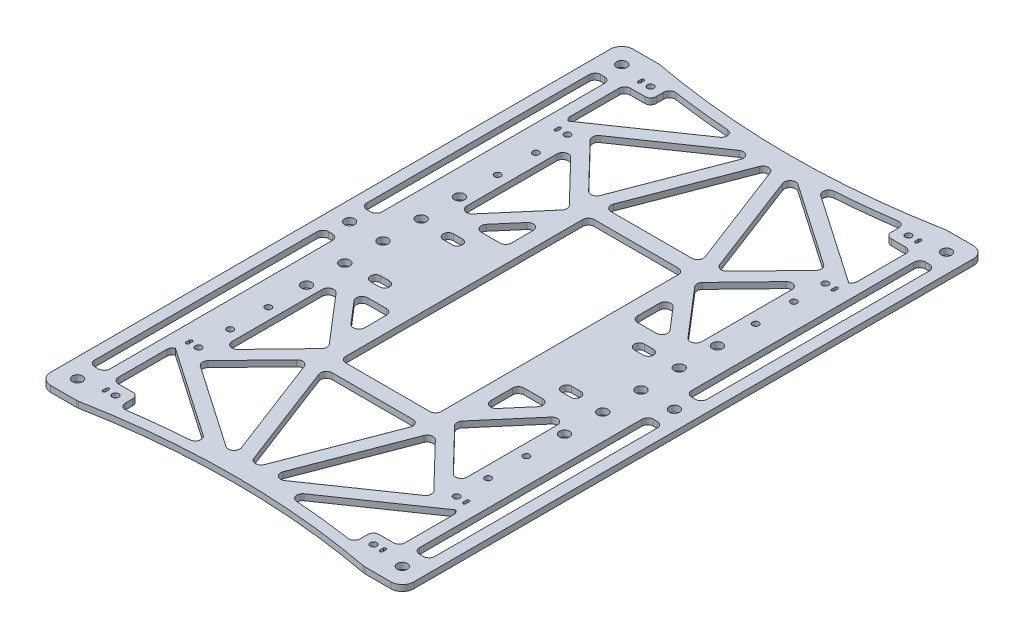
from build123d import *

# Parameters (mm, degrees)
SKETCH1_W                           = 190
SKETCH1_H                           = 304.8
EXTRUDE_RECTANGLE_DEPTH             = 3.175
SKETCH2_W                           = 50
SKETCH2_H                           = 130
WHEEL_HOLE_DEPTH                    = 180.613030221
M5_START                            = -1
M5_CLEARANCE_SLOT2_DEPTH            = 5
SKETCH12_R                          = 2.65
SKETCH12_W                          = 8
SKETCH12_H                          = 122.4
F_8020_STUFF_DEPTH                  = 10
SKETCH22_R                          = 1.65
LITTLE_HOLES_DEPTH                  = 10
SKETCH27_R                          = 2.65
BIG_HOLES_DEPTH                     = 180.613030221
SKETCH28_R                          = 1.65
ODRIVE_HOLES_DEPTH                  = 180.613030221
HOLLOWING_DEPTH                     = 10
TRUSS_DEPTH                         = 3.175
HOLLOWING_TRUSS_MIRROR_COPY_1_DEPTH = 3.175
INNER_START                         = -1
INNER_FILLET_DEPTH                  = 5
INNER_FILLET_2_DEPTH                = 3.175
OUTER_FILLET_R                      = 6


with BuildPart() as part:
    # Sketch1 → extrude rectangle (new body)
    with BuildSketch(Plane(origin=(0, 0, 0), x_dir=(1, 0, 0), z_dir=(0, 1, 0))):
        Rectangle(SKETCH1_W, SKETCH1_H)
    extrude(amount=EXTRUDE_RECTANGLE_DEPTH)

    # Sketch2 → wheel hole (cut, through all)
    with BuildSketch(Plane.XZ):
        Rectangle(SKETCH2_W, SKETCH2_H)
    extrude(amount=-WHEEL_HOLE_DEPTH, mode=Mode.SUBTRACT)

    # M5 Clearance Slot2: read off the stored shape, not the designer's step
    # M5 Clearance Slot2 outline → M5 Clearance Slot2 (cut)
    with BuildSketch(Plane(origin=(0, 0, 0), x_dir=(1, 0, 0), z_dir=(0, 1, 0)).offset(M5_START)):
        with BuildLine():
            ThreePointArc((-52.35, 21.7), (-55, 19.05), (-52.35, 16.4))
            Line((-52.35, 16.4), (-47.65, 16.4))
            ThreePointArc((-47.65, 16.4), (-45, 19.05), (-47.65, 21.7))
            Line((-47.65, 21.7), (-52.35, 21.7))
        make_face()
        with BuildLine():
            ThreePointArc((-52.35, -16.4), (-55, -19.05), (-52.35, -21.7))
            Line((-52.35, -21.7), (-47.65, -21.7))
            ThreePointArc((-47.65, -21.7), (-45, -19.05), (-47.65, -16.4))
            Line((-47.65, -16.4), (-52.35, -16.4))
        make_face()
    m5_clearance_slot2 = extrude(amount=M5_CLEARANCE_SLOT2_DEPTH, mode=Mode.SUBTRACT)

    # Mirror1: M5 Clearance Slot2 across plane
    add(m5_clearance_slot2.mirror(Plane(origin=(0, 0, 0), x_dir=(0, 0, 1), z_dir=(1, 0, 0))), mode=Mode.SUBTRACT)

    # Sketch12 → 8020 stuff (cut)
    with BuildSketch(Plane.XZ):
        with Locations(Location((85, -142.4, 0), (0, 0, 270))):
            Circle(SKETCH12_R)
        with Locations(Location((85, 142.4, 0), (0, 0, 270))):
            Circle(SKETCH12_R)
        with Locations(Location((85, 0, 0), (0, 0, 270))):
            Circle(SKETCH12_R)
        with Locations((85, 71.2)):
            Rectangle(SKETCH12_W, SKETCH12_H)
        with Locations((85, -71.2)):
            Rectangle(SKETCH12_W, SKETCH12_H)
    f_8020_stuff = extrude(amount=-F_8020_STUFF_DEPTH, mode=Mode.SUBTRACT)

    # 8020 stuff mirror: 8020 stuff across plane
    add(f_8020_stuff.mirror(Plane(origin=(0, 0, 0), x_dir=(0, 0, 1), z_dir=(1, 0, 0))), mode=Mode.SUBTRACT)

    # Sketch22 → little holes (cut)
    with BuildSketch(Plane.XZ):
        with Locations(Location((67.5, 140, 0), (0, 0, 270))):
            Circle(SKETCH22_R)
        with Locations(Location((67.5, 80, 0), (0, 0, 270))):
            Circle(SKETCH22_R)
        with Locations(Location((67.5, 60, 0), (0, 0, 270))):
            Circle(SKETCH22_R)
        with Locations(Location((67.5, 40, 0), (0, 0, 270))):
            Circle(SKETCH22_R)
        with Locations(Location((67.5, 20, 0), (0, 0, 270))):
            Circle(SKETCH22_R)
        with Locations(Location((67.5, 0, 0), (0, 0, 270))):
            Circle(SKETCH22_R)
        with Locations(Location((67.5, -20, 0), (0, 0, 270))):
            Circle(SKETCH22_R)
        with Locations(Location((67.5, -40, 0), (0, 0, 270))):
            Circle(SKETCH22_R)
        with Locations(Location((67.5, -60, 0), (0, 0, 270))):
            Circle(SKETCH22_R)
        with Locations(Location((67.5, -80, 0), (0, 0, 270))):
            Circle(SKETCH22_R)
        with Locations(Location((67.5, -140, 0), (0, 0, 270))):
            Circle(SKETCH22_R)
        with Locations(Location((-67.5, 140, 0), (0, 0, 270))):
            Circle(SKETCH22_R)
        with Locations(Location((-67.5, 80, 0), (0, 0, 270))):
            Circle(SKETCH22_R)
        with Locations(Location((-67.5, 60, 0), (0, 0, 270))):
            Circle(SKETCH22_R)
        with Locations(Location((-67.5, 40, 0), (0, 0, 270))):
            Circle(SKETCH22_R)
        with Locations(Location((-67.5, 20, 0), (0, 0, 270))):
            Circle(SKETCH22_R)
        with Locations(Location((-67.5, 0, 0), (0, 0, 270))):
            Circle(SKETCH22_R)
        with Locations(Location((-67.5, -20, 0), (0, 0, 270))):
            Circle(SKETCH22_R)
        with Locations(Location((-67.5, -40, 0), (0, 0, 270))):
            Circle(SKETCH22_R)
        with Locations(Location((-67.5, -60, 0), (0, 0, 270))):
            Circle(SKETCH22_R)
        with Locations(Location((-67.5, -80, 0), (0, 0, 270))):
            Circle(SKETCH22_R)
        with Locations(Location((-67.5, -140, 0), (0, 0, 270))):
            Circle(SKETCH22_R)
    extrude(amount=-LITTLE_HOLES_DEPTH, mode=Mode.SUBTRACT)

    # Sketch27 → big holes (cut, through all)
    with BuildSketch(Plane.XZ):
        with Locations(Location((-67.5, 40, 0), (0, 0, 270))):
            Circle(SKETCH27_R)
        with Locations(Location((-67.5, 20, 0), (0, 0, 270))):
            Circle(SKETCH27_R)
        with Locations(Location((-67.5, 0, 0), (0, 0, 270))):
            Circle(SKETCH27_R)
        with Locations(Location((-67.5, -20, 0), (0, 0, 270))):
            Circle(SKETCH27_R)
        with Locations(Location((-67.5, -40, 0), (0, 0, 270))):
            Circle(SKETCH27_R)
        with Locations(Location((67.5, -40, 0), (0, 0, 90))):
            Circle(SKETCH27_R)
        with Locations(Location((67.5, -20, 0), (0, 0, 90))):
            Circle(SKETCH27_R)
        with Locations(Location((67.5, 0, 0), (0, 0, 90))):
            Circle(SKETCH27_R)
        with Locations(Location((67.5, 20, 0), (0, 0, 90))):
            Circle(SKETCH27_R)
        with Locations(Location((67.5, 40, 0), (0, 0, 90))):
            Circle(SKETCH27_R)
    extrude(amount=-BIG_HOLES_DEPTH, mode=Mode.SUBTRACT)

    # Sketch28 → odrive holes (cut, through all)
    with BuildSketch(Plane.XZ):
        with BuildLine():
            Line((73.25, -97.4), (73.25, -95.6))
            ThreePointArc((73.25, -95.6), (72.5, -94.85), (71.75, -95.6))
            Line((71.75, -95.6), (71.75, -97.4))
            ThreePointArc((71.75, -97.4), (72.5, -98.15), (73.25, -97.4))
        make_face()
        with Locations(Location((67.5, -96.5, 0), (0, 0, 270))):
            Circle(SKETCH28_R)
        with BuildLine():
            Line((73.25, -140.9), (73.25, -139.1))
            ThreePointArc((73.25, -139.1), (72.5, -138.35), (71.75, -139.1))
            Line((71.75, -139.1), (71.75, -140.9))
            ThreePointArc((71.75, -140.9), (72.5, -141.65), (73.25, -140.9))
        make_face()
        with Locations(Location((67.5, -140, 0), (0, 0, 270))):
            Circle(SKETCH28_R)
        with Locations(Location((-67.5, -140, 0), (0, 0, 270))):
            Circle(SKETCH28_R)
        with BuildLine():
            ThreePointArc((-73.25, -139.1), (-72.5, -138.35), (-71.75, -139.1))
            Line((-71.75, -139.1), (-71.75, -140.9))
            ThreePointArc((-71.75, -140.9), (-72.5, -141.65), (-73.25, -140.9))
            Line((-73.25, -140.9), (-73.25, -139.1))
        make_face()
        with BuildLine():
            ThreePointArc((-73.25, -95.6), (-72.5, -94.85), (-71.75, -95.6))
            Line((-71.75, -95.6), (-71.75, -97.4))
            ThreePointArc((-71.75, -97.4), (-72.5, -98.15), (-73.25, -97.4))
            Line((-73.25, -97.4), (-73.25, -95.6))
        make_face()
        with Locations(Location((-67.5, -96.5, 0), (0, 0, 270))):
            Circle(SKETCH28_R)
        with Locations(Location((-67.5, 96.5, 0), (0, 0, 270))):
            Circle(SKETCH28_R)
        with BuildLine():
            Line((-73.25, 97.4), (-73.25, 95.6))
            ThreePointArc((-73.25, 95.6), (-72.5, 94.85), (-71.75, 95.6))
            Line((-71.75, 95.6), (-71.75, 97.4))
            ThreePointArc((-71.75, 97.4), (-72.5, 98.15), (-73.25, 97.4))
        make_face()
        with Locations(Location((-67.5, 140, 0), (0, 0, 270))):
            Circle(SKETCH28_R)
        with BuildLine():
            Line((-73.25, 140.9), (-73.25, 139.1))
            ThreePointArc((-73.25, 139.1), (-72.5, 138.35), (-71.75, 139.1))
            Line((-71.75, 139.1), (-71.75, 140.9))
            ThreePointArc((-71.75, 140.9), (-72.5, 141.65), (-73.25, 140.9))
        make_face()
        with Locations(Location((67.5, 140, 0), (0, 0, 270))):
            Circle(SKETCH28_R)
        with BuildLine():
            ThreePointArc((73.25, 139.1), (72.5, 138.35), (71.75, 139.1))
            Line((71.75, 139.1), (71.75, 140.9))
            ThreePointArc((71.75, 140.9), (72.5, 141.65), (73.25, 140.9))
            Line((73.25, 140.9), (73.25, 139.1))
        make_face()
        with Locations(Location((67.5, 96.5, 0), (0, 0, 270))):
            Circle(SKETCH28_R)
        with BuildLine():
            ThreePointArc((73.25, 95.6), (72.5, 94.85), (71.75, 95.6))
            Line((71.75, 95.6), (71.75, 97.4))
            ThreePointArc((71.75, 97.4), (72.5, 98.15), (73.25, 97.4))
            Line((73.25, 97.4), (73.25, 95.6))
        make_face()
    extrude(amount=-ODRIVE_HOLES_DEPTH, mode=Mode.SUBTRACT)

    # Sketch29 → hollowing (cut)
    with BuildSketch(Plane(origin=(0, 3.175, 0), x_dir=(1, 0, 0), z_dir=(0, 1, 0))):
        with BuildLine():
            Line((-61.5, -134), (-61.5, -144.4))
            ThreePointArc((-61.5, -144.4), (0, -139.643912034), (61.5, -144.4))
            Line((61.5, -144.4), (61.5, -134))
            Line((61.5, -134), (75, -134))
            Line((75, -134), (75, -102.5))
            Line((75, -102.5), (61.5, -102.5))
            Line((61.5, -102.5), (61.5, -29.7))
            Line((61.5, -29.7), (33, -29.7))
            Line((33, -29.7), (33, -73))
            Line((33, -73), (-33, -73))
            Line((-33, -73), (-33, -29.7))
            Line((-33, -29.7), (-61.5, -29.7))
            Line((-61.5, -29.7), (-61.5, -102.5))
            Line((-61.5, -102.5), (-75, -102.5))
            Line((-75, -102.5), (-75, -134))
            Line((-75, -134), (-61.5, -134))
        make_face()
        with BuildLine():
            ThreePointArc((75, -152.4), (0, -145.305841138), (-75, -152.4))
            Line((-75, -152.4), (75, -152.4))
        make_face()
    hollowing = extrude(amount=-HOLLOWING_DEPTH, mode=Mode.SUBTRACT)

    # Sketch30 → truss (add)
    with BuildSketch(Plane(origin=(0, 3.175, 0), x_dir=(1, 0, 0), z_dir=(0, 1, 0))):
        Polygon((-61.5, -29.7), (-33, -62.925332624), (-33, -52.173796773), (-52.277555933, -29.7), align=None)
        Polygon((-61.5, -102.5), (-33, -73), (-33, -62.925332624), (-61.5, -92.425332624), align=None)
        with BuildLine():
            Line((-25.504891263, -73), (-33, -73))
            Line((-33, -73), (-7.468423642, -139.713639801))
            ThreePointArc((-7.468423642, -139.713639801), (-3.734374568, -139.661344356), (0, -139.643912034))
            Line((0, -139.643912034), (-25.504891263, -73))
        make_face()
        with BuildLine():
            Line((-7.468423642, -139.713639801), (-61.5, -102.5))
            Line((-61.5, -102.5), (-73.840860788, -102.5))
            Line((-73.840860788, -102.5), (-19.238406902, -140.10682527))
            ThreePointArc((-19.238406902, -140.10682527), (-13.35486234, -139.866914632), (-7.468423642, -139.713639801))
        make_face()
    truss = extrude(amount=-TRUSS_DEPTH)

    # truss mirror: truss across plane
    add(truss.mirror(Plane(origin=(0, 0, 0), x_dir=(0, 0, 1), z_dir=(1, 0, 0))))

    # hollowing/truss mirror: hollowing, truss across plane
    add(hollowing.mirror(Plane.XY), mode=Mode.SUBTRACT)
    add(truss.mirror(Plane.XY))

    # hollowing/truss mirror copy 1 sketch → hollowing/truss mirror copy 1 (add)
    with BuildSketch(Plane(origin=(0, 3.175, 0), x_dir=(-1, 0, 0), z_dir=(0, 1, 0))):
        Polygon((-61.5, -29.7), (-33, -62.925332624), (-33, -52.173796773), (-52.277555933, -29.7), align=None)
        Polygon((-61.5, -102.5), (-33, -73), (-33, -62.925332624), (-61.5, -92.425332624), align=None)
        with BuildLine():
            Line((-25.504891263, -73), (-33, -73))
            Line((-33, -73), (-7.468423642, -139.713639801))
            ThreePointArc((-7.468423642, -139.713639801), (-3.734374568, -139.661344356), (0, -139.643912034))
            Line((0, -139.643912034), (-25.504891263, -73))
        make_face()
        with BuildLine():
            Line((-7.468423642, -139.713639801), (-61.5, -102.5))
            Line((-61.5, -102.5), (-73.840860788, -102.5))
            Line((-73.840860788, -102.5), (-19.238406902, -140.10682527))
            ThreePointArc((-19.238406902, -140.10682527), (-13.35486234, -139.866914632), (-7.468423642, -139.713639801))
        make_face()
    extrude(amount=-HOLLOWING_TRUSS_MIRROR_COPY_1_DEPTH)

    # inner fillet: read off the stored shape, not the designer's step
    # inner fillet outline → inner fillet (cut)
    with BuildSketch(Plane(origin=(0, 0, 0), x_dir=(1, 0, 0), z_dir=(0, 1, 0)).offset(INNER_START)):
        with BuildLine():
            ThreePointArc((-64.5, -134), (-62.378679656, -134.878679656), (-61.5, -137))
            Line((-61.5, -137), (-61.5, -134))
            Line((-61.5, -134), (-64.5, -134))
        make_face()
        with BuildLine():
            ThreePointArc((61.5, -137), (62.378679656, -134.878679656), (64.5, -134))
            Line((64.5, -134), (61.5, -134))
            Line((61.5, -134), (61.5, -137))
        make_face()
        with BuildLine():
            ThreePointArc((-61.5, 137), (-62.378679656, 134.878679656), (-64.5, 134))
            Line((-64.5, 134), (-61.5, 134))
            Line((-61.5, 134), (-61.5, 137))
        make_face()
        with BuildLine():
            ThreePointArc((64.5, 134), (62.378679656, 134.878679656), (61.5, 137))
            Line((61.5, 137), (61.5, 134))
            Line((61.5, 134), (64.5, 134))
        make_face()
    extrude(amount=INNER_FILLET_DEPTH, mode=Mode.SUBTRACT)

    # inner fillet 2 outline → inner fillet 2 (add)
    with BuildSketch(Plane(origin=(0, 0, 0), x_dir=(1, 0, 0), z_dir=(0, 1, 0))):
        with BuildLine():
            ThreePointArc((-58.064516129, -143.880710149), (-60.461319503, -143.182557897), (-61.5, -140.912486134))
            Line((-61.5, -140.912486134), (-61.5, -144.4))
            ThreePointArc((-61.5, -144.4), (-59.782821904, -144.136624863), (-58.064516129, -143.880710149))
        make_face()
        with BuildLine():
            ThreePointArc((-26.426582916, -135.156049982), (-25.234259681, -138.417212526), (-27.918855618, -140.619429701))
            ThreePointArc((-27.918855618, -140.619429701), (-23.580024235, -140.339538834), (-19.238406902, -140.10682527))
            Line((-19.238406902, -140.10682527), (-26.426582916, -135.156049982))
        make_face()
        with BuildLine():
            Line((-75, -134), (-72, -134))
            ThreePointArc((-72, -134), (-74.121320344, -133.121320344), (-75, -131))
            Line((-75, -131), (-75, -134))
        make_face()
        with BuildLine():
            ThreePointArc((-73.387006517, -102.839884792), (-73.226776312, -102.929774616), (-73.072348915, -103.029303898))
            Line((-73.072348915, -103.029303898), (-73.840860788, -102.5))
            Line((-73.840860788, -102.5), (-75, -102.5))
            Line((-75, -102.5), (-75, -105.5))
            ThreePointArc((-75, -105.5), (-74.565250431, -103.944528938), (-73.387006517, -102.839884792))
        make_face()
        with BuildLine():
            ThreePointArc((-84, 132.4), (-81.878679656, 131.521320344), (-81, 129.4))
            Line((-81, 129.4), (-81, 132.4))
            Line((-81, 132.4), (-84, 132.4))
        make_face()
        with BuildLine():
            Line((-81, 10), (-81, 13))
            ThreePointArc((-81, 13), (-81.878679656, 10.878679656), (-84, 10))
            Line((-84, 10), (-81, 10))
        make_face()
        with BuildLine():
            ThreePointArc((-89, 129.4), (-88.121320344, 131.521320344), (-86, 132.4))
            Line((-86, 132.4), (-89, 132.4))
            Line((-89, 132.4), (-89, 129.4))
        make_face()
        with BuildLine():
            Line((-89, 10), (-86, 10))
            ThreePointArc((-86, 10), (-88.121320344, 10.878679656), (-89, 13))
            Line((-89, 13), (-89, 10))
        make_face()
        with BuildLine():
            ThreePointArc((89, 13), (88.121320344, 10.878679656), (86, 10))
            Line((86, 10), (89, 10))
            Line((89, 10), (89, 13))
        make_face()
        with BuildLine():
            Line((81, 10), (84, 10))
            ThreePointArc((84, 10), (81.878679656, 10.878679656), (81, 13))
            Line((81, 13), (81, 10))
        make_face()
        with BuildLine():
            ThreePointArc((86, 132.4), (88.121320344, 131.521320344), (89, 129.4))
            Line((89, 129.4), (89, 132.4))
            Line((89, 132.4), (86, 132.4))
        make_face()
        with BuildLine():
            Line((81, 132.4), (81, 129.4))
            ThreePointArc((81, 129.4), (81.878679656, 131.521320344), (84, 132.4))
            Line((84, 132.4), (81, 132.4))
        make_face()
        with BuildLine():
            ThreePointArc((-22, -65), (-24.121320344, -64.121320344), (-25, -62))
            Line((-25, -62), (-25, -65))
            Line((-25, -65), (-22, -65))
        make_face()
        with BuildLine():
            Line((-25, 65), (-25, 62))
            ThreePointArc((-25, 62), (-24.121320344, 64.121320344), (-22, 65))
            Line((-22, 65), (-25, 65))
        make_face()
        with BuildLine():
            ThreePointArc((25, -62), (24.121320344, -64.121320344), (22, -65))
            Line((22, -65), (25, -65))
            Line((25, -65), (25, -62))
        make_face()
        with BuildLine():
            Line((25, 65), (22, 65))
            ThreePointArc((22, 65), (24.121320344, 64.121320344), (25, 62))
            Line((25, 62), (25, 65))
        make_face()
        with BuildLine():
            Line((89, -132.4), (89, -129.4))
            ThreePointArc((89, -129.4), (88.121320344, -131.521320344), (86, -132.4))
            Line((86, -132.4), (89, -132.4))
        make_face()
        with BuildLine():
            ThreePointArc((86, -10), (88.121320344, -10.878679656), (89, -13))
            Line((89, -13), (89, -10))
            Line((89, -10), (86, -10))
        make_face()
        with BuildLine():
            Line((81, -132.4), (84, -132.4))
            ThreePointArc((84, -132.4), (81.878679656, -131.521320344), (81, -129.4))
            Line((81, -129.4), (81, -132.4))
        make_face()
        with BuildLine():
            ThreePointArc((81, -13), (81.878679656, -10.878679656), (84, -10))
            Line((84, -10), (81, -10))
            Line((81, -10), (81, -13))
        make_face()
        with BuildLine():
            Line((-81, -10), (-84, -10))
            ThreePointArc((-84, -10), (-81.878679656, -10.878679656), (-81, -13))
            Line((-81, -13), (-81, -10))
        make_face()
        with BuildLine():
            ThreePointArc((-89, -13), (-88.121320344, -10.878679656), (-86, -10))
            Line((-86, -10), (-89, -10))
            Line((-89, -10), (-89, -13))
        make_face()
        with BuildLine():
            Line((-81, -132.4), (-81, -129.4))
            ThreePointArc((-81, -129.4), (-81.878679656, -131.521320344), (-84, -132.4))
            Line((-84, -132.4), (-81, -132.4))
        make_face()
        with BuildLine():
            ThreePointArc((-86, -132.4), (-88.121320344, -131.521320344), (-89, -129.4))
            Line((-89, -129.4), (-89, -132.4))
            Line((-89, -132.4), (-86, -132.4))
        make_face()
        with BuildLine():
            Line((-33, -52.173796773), (-33, -44.068592261))
            ThreePointArc((-33, -44.068592261), (-34.958645347, -46.882056404), (-38.277053658, -46.021801578))
            Line((-38.277053658, -46.021801578), (-33, -52.173796773))
        make_face()
        with BuildLine():
            ThreePointArc((-36, -29.7), (-33.878679656, -30.578679656), (-33, -32.7))
            Line((-33, -32.7), (-33, -29.7))
            Line((-33, -29.7), (-36, -29.7))
        make_face()
        with BuildLine():
            Line((-52.277555933, -29.7), (-48.028795893, -34.653209317))
            ThreePointArc((-48.028795893, -34.653209317), (-48.477510746, -31.446929362), (-45.751742235, -29.7))
            Line((-45.751742235, -29.7), (-52.277555933, -29.7))
        make_face()
        with BuildLine():
            Line((-61.5, -29.7), (-61.5, -37.805204513))
            ThreePointArc((-61.5, -37.805204513), (-59.541354653, -34.991740369), (-56.222946342, -35.851995195))
            Line((-56.222946342, -35.851995195), (-61.5, -29.7))
        make_face()
        with BuildLine():
            ThreePointArc((-56.34242583, -87.086790939), (-59.624116873, -87.783786388), (-61.5, -85.002354876))
            Line((-61.5, -85.002354876), (-61.5, -92.425332624))
            Line((-61.5, -92.425332624), (-56.34242583, -87.086790939))
        make_face()
        with BuildLine():
            Line((-33, -62.925332624), (-34.778360413, -60.852118018))
            ThreePointArc((-34.778360413, -60.852118018), (-34.056726684, -62.894062625), (-34.897839901, -64.889763398))
            Line((-34.897839901, -64.889763398), (-33, -62.925332624))
        make_face()
        with BuildLine():
            ThreePointArc((33, -32.7), (33.878679656, -30.578679656), (36, -29.7))
            Line((36, -29.7), (33, -29.7))
            Line((33, -29.7), (33, -32.7))
        make_face()
        with BuildLine():
            Line((52.277555933, -29.7), (45.751742235, -29.7))
            ThreePointArc((45.751742235, -29.7), (48.477510746, -31.446929362), (48.028795893, -34.653209317))
            Line((48.028795893, -34.653209317), (52.277555933, -29.7))
        make_face()
        with BuildLine():
            ThreePointArc((38.277053658, -46.021801578), (34.958645347, -46.882056404), (33, -44.068592261))
            Line((33, -44.068592261), (33, -52.173796773))
            Line((33, -52.173796773), (38.277053658, -46.021801578))
        make_face()
        with BuildLine():
            Line((-61.5, -102.5), (-58.583790521, -104.508506441))
            ThreePointArc((-58.583790521, -104.508506441), (-59.867212214, -102.336578976), (-59.039700572, -99.953374277))
            Line((-59.039700572, -99.953374277), (-61.5, -102.5))
        make_face()
        with BuildLine():
            ThreePointArc((-10.921564666, -130.690632242), (-11.868467999, -134.120710437), (-15.425056048, -134.233598826))
            Line((-15.425056048, -134.233598826), (-7.468423642, -139.713639801))
            Line((-7.468423642, -139.713639801), (-10.921564666, -130.690632242))
        make_face()
        with BuildLine():
            Line((-33, -73), (-36.274791322, -76.38969628))
            ThreePointArc((-36.274791322, -76.38969628), (-33.51731274, -75.534725141), (-31.315389888, -77.401861861))
            Line((-31.315389888, -77.401861861), (-33, -73))
        make_face()
        with BuildLine():
            ThreePointArc((2.801827263, -132.322777914), (0, -134.250507431), (-2.801827263, -132.322777914))
            Line((-2.801827263, -132.322777914), (0, -139.643912034))
            Line((0, -139.643912034), (2.801827263, -132.322777914))
        make_face()
        with BuildLine():
            Line((-25.504891263, -73), (-23.946417088, -77.072270482))
            ThreePointArc((-23.946417088, -77.072270482), (-23.616108735, -74.29953116), (-21.144589825, -73))
            Line((-21.144589825, -73), (-25.504891263, -73))
        make_face()
        with BuildLine():
            ThreePointArc((21.144589825, -73), (23.616108735, -74.29953116), (23.946417088, -77.072270482))
            Line((23.946417088, -77.072270482), (25.504891263, -73))
            Line((25.504891263, -73), (21.144589825, -73))
        make_face()
        with BuildLine():
            Line((61.5, -29.7), (56.222946342, -35.851995195))
            ThreePointArc((56.222946342, -35.851995195), (59.541354653, -34.991740369), (61.5, -37.805204513))
            Line((61.5, -37.805204513), (61.5, -29.7))
        make_face()
        with BuildLine():
            ThreePointArc((34.897839901, -64.889763398), (34.056726684, -62.894062625), (34.778360413, -60.852118018))
            Line((34.778360413, -60.852118018), (33, -62.925332624))
            Line((33, -62.925332624), (34.897839901, -64.889763398))
        make_face()
        with BuildLine():
            Line((61.5, -92.425332624), (61.5, -85.002354876))
            ThreePointArc((61.5, -85.002354876), (59.624116873, -87.783786388), (56.34242583, -87.086790939))
            Line((56.34242583, -87.086790939), (61.5, -92.425332624))
        make_face()
        with BuildLine():
            ThreePointArc((73.072348915, -103.029303898), (73.226776312, -102.929774616), (73.387006517, -102.839884792))
            ThreePointArc((73.387006517, -102.839884792), (74.565250431, -103.944528938), (75, -105.5))
            Line((75, -105.5), (75, -102.5))
            Line((75, -102.5), (73.840860788, -102.5))
            Line((73.840860788, -102.5), (73.072348915, -103.029303898))
        make_face()
        with BuildLine():
            Line((75, -134), (75, -131))
            ThreePointArc((75, -131), (74.121320344, -133.121320344), (72, -134))
            Line((72, -134), (75, -134))
        make_face()
        with BuildLine():
            ThreePointArc((27.918855618, -140.619429701), (25.234259681, -138.417212526), (26.426582916, -135.156049982))
            Line((26.426582916, -135.156049982), (19.238406902, -140.10682527))
            ThreePointArc((19.238406902, -140.10682527), (23.580024235, -140.339538834), (27.918855618, -140.619429701))
        make_face()
        with BuildLine():
            ThreePointArc((61.5, -140.912486134), (60.461319503, -143.182557897), (58.064516129, -143.880710149))
            ThreePointArc((58.064516129, -143.880710149), (59.782821904, -144.136624863), (61.5, -144.4))
            Line((61.5, -144.4), (61.5, -140.912486134))
        make_face()
        with BuildLine():
            ThreePointArc((31.315389888, -77.401861861), (33.51731274, -75.534725141), (36.274791322, -76.38969628))
            Line((36.274791322, -76.38969628), (33, -73))
            Line((33, -73), (31.315389888, -77.401861861))
        make_face()
        with BuildLine():
            Line((61.5, -102.5), (59.039700572, -99.953374277))
            ThreePointArc((59.039700572, -99.953374277), (59.867212214, -102.336578976), (58.583790521, -104.508506441))
            Line((58.583790521, -104.508506441), (61.5, -102.5))
        make_face()
        with BuildLine():
            ThreePointArc((15.425056048, -134.233598826), (11.868467999, -134.120710437), (10.921564666, -130.690632242))
            Line((10.921564666, -130.690632242), (7.468423642, -139.713639801))
            Line((7.468423642, -139.713639801), (15.425056048, -134.233598826))
        make_face()
        with BuildLine():
            ThreePointArc((-33, 32.7), (-33.878679656, 30.578679656), (-36, 29.7))
            Line((-36, 29.7), (-33, 29.7))
            Line((-33, 29.7), (-33, 32.7))
        make_face()
        with BuildLine():
            Line((-52.277555933, 29.7), (-45.751742235, 29.7))
            ThreePointArc((-45.751742235, 29.7), (-48.477510746, 31.446929362), (-48.028795893, 34.653209317))
            Line((-48.028795893, 34.653209317), (-52.277555933, 29.7))
        make_face()
        with BuildLine():
            ThreePointArc((-38.277053658, 46.021801578), (-34.958645347, 46.882056404), (-33, 44.068592261))
            Line((-33, 44.068592261), (-33, 52.173796773))
            Line((-33, 52.173796773), (-38.277053658, 46.021801578))
        make_face()
        with BuildLine():
            ThreePointArc((-73.387006517, 102.839884792), (-74.565250431, 103.944528938), (-75, 105.5))
            Line((-75, 105.5), (-75, 102.5))
            Line((-75, 102.5), (-73.840860788, 102.5))
            Line((-73.840860788, 102.5), (-73.072348915, 103.029303898))
            ThreePointArc((-73.072348915, 103.029303898), (-73.226776312, 102.929774616), (-73.387006517, 102.839884792))
        make_face()
        with BuildLine():
            Line((-75, 134), (-75, 131))
            ThreePointArc((-75, 131), (-74.121320344, 133.121320344), (-72, 134))
            Line((-72, 134), (-75, 134))
        make_face()
        with BuildLine():
            ThreePointArc((-27.918855618, 140.619429701), (-25.234259681, 138.417212526), (-26.426582916, 135.156049982))
            Line((-26.426582916, 135.156049982), (-19.238406902, 140.10682527))
            ThreePointArc((-19.238406902, 140.10682527), (-23.580024235, 140.339538834), (-27.918855618, 140.619429701))
        make_face()
        with BuildLine():
            ThreePointArc((-61.5, 140.912486134), (-60.461319503, 143.182557897), (-58.064516129, 143.880710149))
            ThreePointArc((-58.064516129, 143.880710149), (-59.782821904, 144.136624863), (-61.5, 144.4))
            Line((-61.5, 144.4), (-61.5, 140.912486134))
        make_face()
        with BuildLine():
            Line((-61.5, 29.7), (-56.222946342, 35.851995195))
            ThreePointArc((-56.222946342, 35.851995195), (-59.541354653, 34.991740369), (-61.5, 37.805204513))
            Line((-61.5, 37.805204513), (-61.5, 29.7))
        make_face()
        with BuildLine():
            ThreePointArc((-34.897839901, 64.889763398), (-34.056726684, 62.894062625), (-34.778360413, 60.852118018))
            Line((-34.778360413, 60.852118018), (-33, 62.925332624))
            Line((-33, 62.925332624), (-34.897839901, 64.889763398))
        make_face()
        with BuildLine():
            Line((-61.5, 92.425332624), (-61.5, 85.002354876))
            ThreePointArc((-61.5, 85.002354876), (-59.624116873, 87.783786388), (-56.34242583, 87.086790939))
            Line((-56.34242583, 87.086790939), (-61.5, 92.425332624))
        make_face()
        with BuildLine():
            Line((25.504891263, 73), (23.946417088, 77.072270482))
            ThreePointArc((23.946417088, 77.072270482), (23.616108735, 74.29953116), (21.144589825, 73))
            Line((21.144589825, 73), (25.504891263, 73))
        make_face()
        with BuildLine():
            ThreePointArc((-2.801827263, 132.322777914), (0, 134.250507431), (2.801827263, 132.322777914))
            Line((2.801827263, 132.322777914), (0, 139.643912034))
            Line((0, 139.643912034), (-2.801827263, 132.322777914))
        make_face()
        with BuildLine():
            Line((-25.504891263, 73), (-21.144589825, 73))
            ThreePointArc((-21.144589825, 73), (-23.616108735, 74.29953116), (-23.946417088, 77.072270482))
            Line((-23.946417088, 77.072270482), (-25.504891263, 73))
        make_face()
        with BuildLine():
            ThreePointArc((-31.315389888, 77.401861861), (-33.51731274, 75.534725141), (-36.274791322, 76.38969628))
            Line((-36.274791322, 76.38969628), (-33, 73))
            Line((-33, 73), (-31.315389888, 77.401861861))
        make_face()
        with BuildLine():
            Line((-61.5, 102.5), (-59.039700572, 99.953374277))
            ThreePointArc((-59.039700572, 99.953374277), (-59.867212214, 102.336578976), (-58.583790521, 104.508506441))
            Line((-58.583790521, 104.508506441), (-61.5, 102.5))
        make_face()
        with BuildLine():
            ThreePointArc((-15.425056048, 134.233598826), (-11.868467999, 134.120710437), (-10.921564666, 130.690632242))
            Line((-10.921564666, 130.690632242), (-7.468423642, 139.713639801))
            Line((-7.468423642, 139.713639801), (-15.425056048, 134.233598826))
        make_face()
        with BuildLine():
            ThreePointArc((36, 29.7), (33.878679656, 30.578679656), (33, 32.7))
            Line((33, 32.7), (33, 29.7))
            Line((33, 29.7), (36, 29.7))
        make_face()
        with BuildLine():
            Line((33, 52.173796773), (33, 44.068592261))
            ThreePointArc((33, 44.068592261), (34.958645347, 46.882056404), (38.277053658, 46.021801578))
            Line((38.277053658, 46.021801578), (33, 52.173796773))
        make_face()
        with BuildLine():
            ThreePointArc((48.028795893, 34.653209317), (48.477510746, 31.446929362), (45.751742235, 29.7))
            Line((45.751742235, 29.7), (52.277555933, 29.7))
            Line((52.277555933, 29.7), (48.028795893, 34.653209317))
        make_face()
        with BuildLine():
            Line((61.5, 29.7), (61.5, 37.805204513))
            ThreePointArc((61.5, 37.805204513), (59.541354653, 34.991740369), (56.222946342, 35.851995195))
            Line((56.222946342, 35.851995195), (61.5, 29.7))
        make_face()
        with BuildLine():
            ThreePointArc((56.34242583, 87.086790939), (59.624116873, 87.783786388), (61.5, 85.002354876))
            Line((61.5, 85.002354876), (61.5, 92.425332624))
            Line((61.5, 92.425332624), (56.34242583, 87.086790939))
        make_face()
        with BuildLine():
            Line((33, 62.925332624), (34.778360413, 60.852118018))
            ThreePointArc((34.778360413, 60.852118018), (34.056726684, 62.894062625), (34.897839901, 64.889763398))
            Line((34.897839901, 64.889763398), (33, 62.925332624))
        make_face()
        with BuildLine():
            ThreePointArc((58.064516129, 143.880710149), (60.461319503, 143.182557897), (61.5, 140.912486134))
            Line((61.5, 140.912486134), (61.5, 144.4))
            ThreePointArc((61.5, 144.4), (59.782821904, 144.136624863), (58.064516129, 143.880710149))
        make_face()
        with BuildLine():
            ThreePointArc((26.426582916, 135.156049982), (25.234259681, 138.417212526), (27.918855618, 140.619429701))
            ThreePointArc((27.918855618, 140.619429701), (23.580024235, 140.339538834), (19.238406902, 140.10682527))
            Line((19.238406902, 140.10682527), (26.426582916, 135.156049982))
        make_face()
        with BuildLine():
            Line((75, 134), (72, 134))
            ThreePointArc((72, 134), (74.121320344, 133.121320344), (75, 131))
            Line((75, 131), (75, 134))
        make_face()
        with BuildLine():
            ThreePointArc((73.387006517, 102.839884792), (73.226776312, 102.929774616), (73.072348915, 103.029303898))
            Line((73.072348915, 103.029303898), (73.840860788, 102.5))
            Line((73.840860788, 102.5), (75, 102.5))
            Line((75, 102.5), (75, 105.5))
            ThreePointArc((75, 105.5), (74.565250431, 103.944528938), (73.387006517, 102.839884792))
        make_face()
        with BuildLine():
            Line((61.5, 102.5), (58.583790521, 104.508506441))
            ThreePointArc((58.583790521, 104.508506441), (59.867212214, 102.336578976), (59.039700572, 99.953374277))
            Line((59.039700572, 99.953374277), (61.5, 102.5))
        make_face()
        with BuildLine():
            ThreePointArc((10.921564666, 130.690632242), (11.868467999, 134.120710437), (15.425056048, 134.233598826))
            Line((15.425056048, 134.233598826), (7.468423642, 139.713639801))
            Line((7.468423642, 139.713639801), (10.921564666, 130.690632242))
        make_face()
        with BuildLine():
            Line((33, 73), (36.274791322, 76.38969628))
            ThreePointArc((36.274791322, 76.38969628), (33.51731274, 75.534725141), (31.315389888, 77.401861861))
            Line((31.315389888, 77.401861861), (33, 73))
        make_face()
    extrude(amount=INNER_FILLET_2_DEPTH)

    # outer fillet
    outer_fillet_edges = [part.edges().sort_by_distance(p)[0] for p in [
        (75, 1.5875, 152.4),
        (-75, 1.5875, 152.4),
        (-75, 1.5875, -152.4),
        (75, 1.5875, -152.4),
        (95, 1.5875, 152.4),
        (-95, 1.5875, 152.4),
        (-95, 1.5875, -152.4),
        (95, 1.5875, -152.4),
    ]]
    fillet(outer_fillet_edges, radius=OUTER_FILLET_R)


solid = part.part
